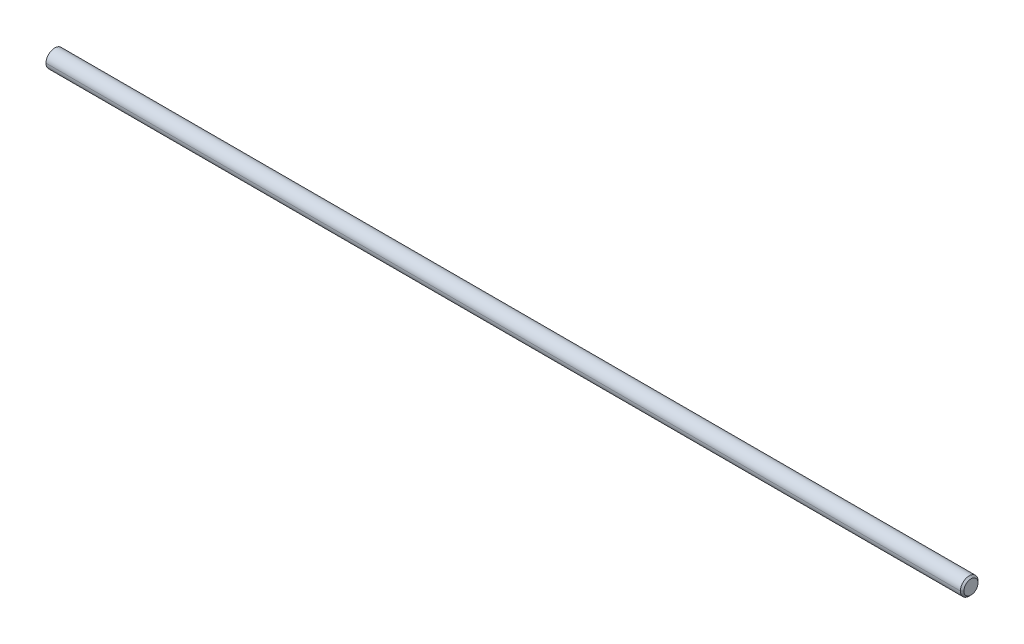
from build123d import *

# Parameters (mm, degrees)
CUT_EXTRUDE1_DEPTH      = 153.416535561
CUT_EXTRUDE1_DEPTH_BACK = 153.416535561
SKETCH1_W               = 139.7
SKETCH1_H               = 3.175


# Read off the part's stored shape, not the designer's step: Stock-CR25-101-17-1
with BuildPart() as part:
    # Stock-CR25-101-17-1 outline → Stock-CR25-101-17-1 (revolve)
    with BuildSketch(Plane.YX):
        Polygon((1.5875, 152.0825), (1.27, 152.4), (0, 152.4), (0, -152.4), (1.27, -152.4), (1.5875, -152.0825), align=None)
    revolve(axis=Axis((0, 0, 0), (1, 0, 0)))

    # Sketch1 → Cut-Extrude1 (cut, two sides: drawn at the far end of the back side and taken through both)
    with BuildSketch(Plane.XY.offset(-CUT_EXTRUDE1_DEPTH_BACK)):
        with Locations((-82.55, 0)):
            Rectangle(SKETCH1_W, SKETCH1_H)
    extrude(amount=CUT_EXTRUDE1_DEPTH + CUT_EXTRUDE1_DEPTH_BACK, mode=Mode.SUBTRACT)


solid = part.part
